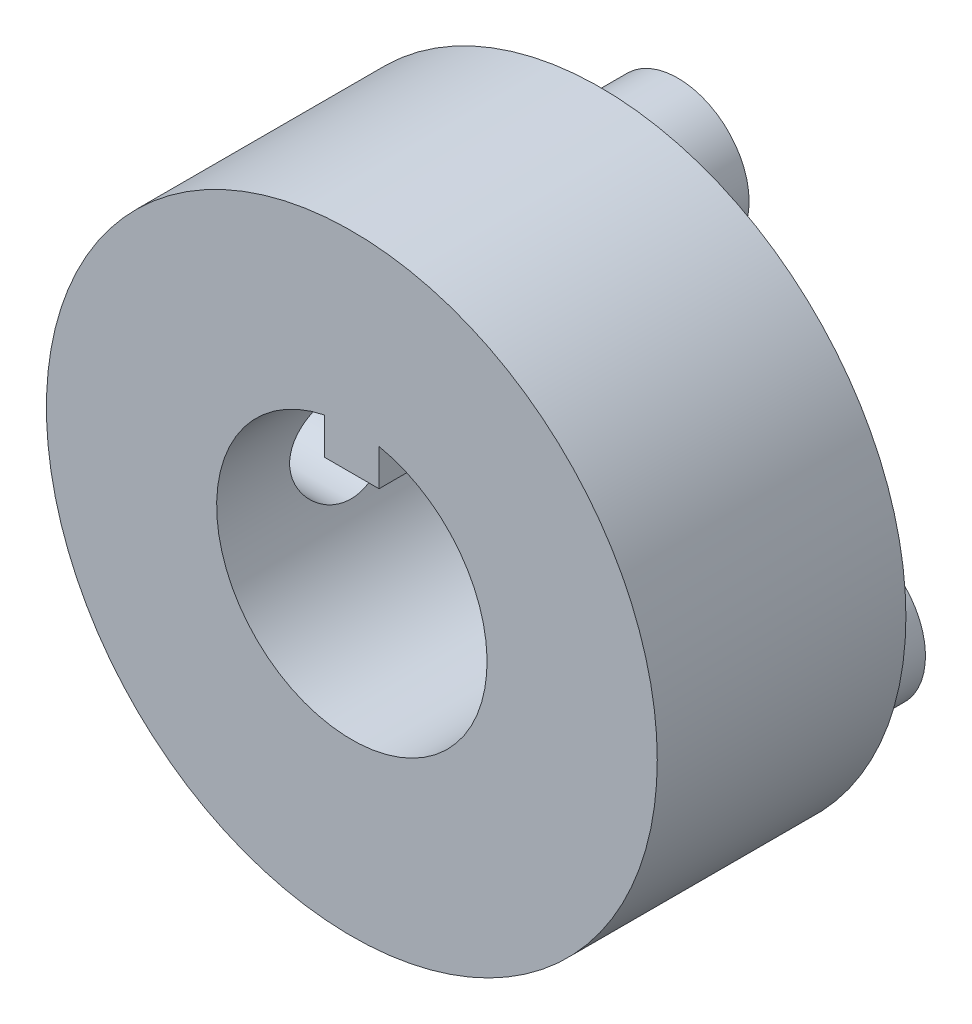
from build123d import *

# Parameters (mm, degrees)
GEARFACEPROFILE_R        = 15
GEARFACEEXTRUDE_DEPTH    = 12.21
CENTERSLOT_DEPTH         = 25.476194557
GEARCONNECTORS_OUTLINE_R = 3.5
GEARCONNECTORS_DEPTH     = 3.8
SETSCREWPROFILE_R        = 2.52
SETSCREWHOLE_DEPTH       = 25.476194557


# Read off the part's stored shape, not the designer's step: GearConnectors
with BuildPart() as part:
    # GearFaceProfile → GearFaceExtrude (new body)
    with BuildSketch(Plane.XY):
        Circle(GEARFACEPROFILE_R)
    extrude(amount=GEARFACEEXTRUDE_DEPTH)

    # Sketch1 → CenterSlot (cut, through all)
    with BuildSketch(Plane.XY.offset(12.21)):
        with BuildLine():
            Line((-1.335, 6.504411964), (-1.335, 4.704411964))
            Line((-1.335, 4.704411964), (1.335, 4.704411964))
            Line((1.335, 4.704411964), (1.335, 6.504411964))
            ThreePointArc((1.335, 6.504411964), (0, -6.64), (-1.335, 6.504411964))
        make_face()
    extrude(amount=-CENTERSLOT_DEPTH, mode=Mode.SUBTRACT)

    # GearConnectors outline → GearConnectors (add)
    with BuildSketch(Plane(origin=(0, 0, 0), x_dir=(-1, 0, 0), z_dir=(0, 0, -1))):
        with BuildLine():
            ThreePointArc((5.310262334, -3.986315836), (11.691342952, -6.749999998), (6.107381948, -2.605664164))
            ThreePointArc((6.107381948, -2.605664164), (5.750408681, -3.32), (5.310262334, -3.986315836))
        make_face()
        with BuildLine():
            ThreePointArc((-6.107381948, -2.605664164), (-11.691342952, -6.749999998), (-5.310262334, -3.986315836))
            ThreePointArc((-5.310262334, -3.986315836), (-5.750408681, -3.32), (-6.107381948, -2.605664164))
        make_face()
        with Locations((0, 10)):
            Circle(GEARCONNECTORS_OUTLINE_R)
    extrude(amount=GEARCONNECTORS_DEPTH)

    # SetScrewProfile → SetScrewHole (cut, through all)
    with BuildSketch(Plane(origin=(0, 0, 0), x_dir=(0, 0, -1), z_dir=(1, 0, 0))):
        with Locations((-6.105, 0)):
            Circle(SETSCREWPROFILE_R)
    extrude(amount=-SETSCREWHOLE_DEPTH, mode=Mode.SUBTRACT)


solid = part.part
